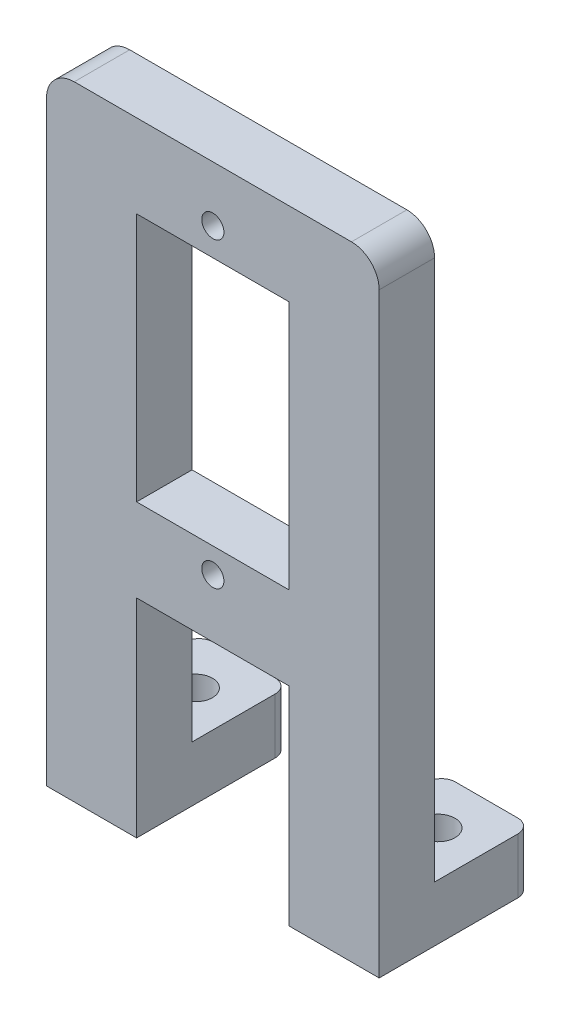
from build123d import *

# Parameters (mm, degrees)
SKETCH1_W           = 8.255
SKETCH1_H           = 19.05
SKETCH1_W_2         = 13.97
SKETCH1_H_2         = 22.86
BOSS_EXTRUDE1_DEPTH = 5.08
FILLET1_R           = 2.54
SKETCH3_W           = 8.255
SKETCH3_H           = 8.89
BOSS_EXTRUDE2_DEPTH = 5.08
SKETCH5_R           = 1.016
CUT_EXTRUDE1_DEPTH  = 5.08
SKETCH6_R           = 1.55
CUT_EXTRUDE2_DEPTH  = 5.08
FILLET2_R           = 1.27


with BuildPart() as part:
    # Sketch1 → Boss-Extrude1 (new body)
    # profile 1 of 3: a face of its own
    with BuildSketch(Plane.XY):
        with Locations((-11.1125, -28.575)):
            Rectangle(SKETCH1_W, SKETCH1_H)
    # profile 2 of 3: a face of its own
    with BuildSketch(Plane.XY):
        Polygon((-15.24, 19.05), (-15.24, -19.05), (-6.985, -19.05), (6.985, -19.05), (15.24, -19.05), (15.24, 19.05), align=None)
        Rectangle(SKETCH1_W_2, SKETCH1_H_2, mode=Mode.SUBTRACT)
    # profile 3 of 3: a face of its own
    with BuildSketch(Plane.XY):
        with Locations((11.1125, -28.575)):
            Rectangle(SKETCH1_W, SKETCH1_H)
    extrude(amount=BOSS_EXTRUDE1_DEPTH)

    # Fillet1
    fillet1_edges = [part.edges().sort_by_distance(p)[0] for p in [
        (15.24, 19.05, 2.54),
        (-15.24, 19.05, 2.54),
    ]]
    fillet(fillet1_edges, radius=FILLET1_R)

    # Sketch3 → Boss-Extrude2 (add)
    with BuildSketch(Plane(origin=(0, -38.1, 0), x_dir=(1, 0, 0), z_dir=(0, 1, 0))):
        with Locations((-11.1125, 4.445)):
            Rectangle(SKETCH3_W, SKETCH3_H)
    boss_extrude2 = extrude(amount=BOSS_EXTRUDE2_DEPTH)

    # Sketch5 → Cut-Extrude1 (cut)
    with BuildSketch(Plane.XY.offset(5.08)):
        with Locations((0, 13.97)):
            Circle(SKETCH5_R)
        with Locations((0, -13.716)):
            Circle(SKETCH5_R)
    extrude(amount=-CUT_EXTRUDE1_DEPTH, mode=Mode.SUBTRACT)

    # Sketch6 → Cut-Extrude2 (cut)
    with BuildSketch(Plane(origin=(0, -33.02, 0), x_dir=(1, 0, 0), z_dir=(0, 1, 0))):
        with Locations((-11.1125, 4.445)):
            Circle(SKETCH6_R)
    cut_extrude2 = extrude(amount=-CUT_EXTRUDE2_DEPTH, mode=Mode.SUBTRACT)

    # Mirror2: Boss-Extrude2, Cut-Extrude2 across plane
    add(boss_extrude2.mirror(Plane(origin=(0, 0, 0), x_dir=(0, 0, 1), z_dir=(1, 0, 0))))
    add(cut_extrude2.mirror(Plane(origin=(0, 0, 0), x_dir=(0, 0, 1), z_dir=(1, 0, 0))), mode=Mode.SUBTRACT)

    # Fillet2
    fillet2_edges = [part.edges().sort_by_distance(p)[0] for p in [
        (-6.985, -35.56, -8.89),
        (15.24, -35.56, -8.89),
        (6.985, -35.56, -8.89),
        (-15.24, -35.56, -8.89),
    ]]
    fillet(fillet2_edges, radius=FILLET2_R)


solid = part.part
